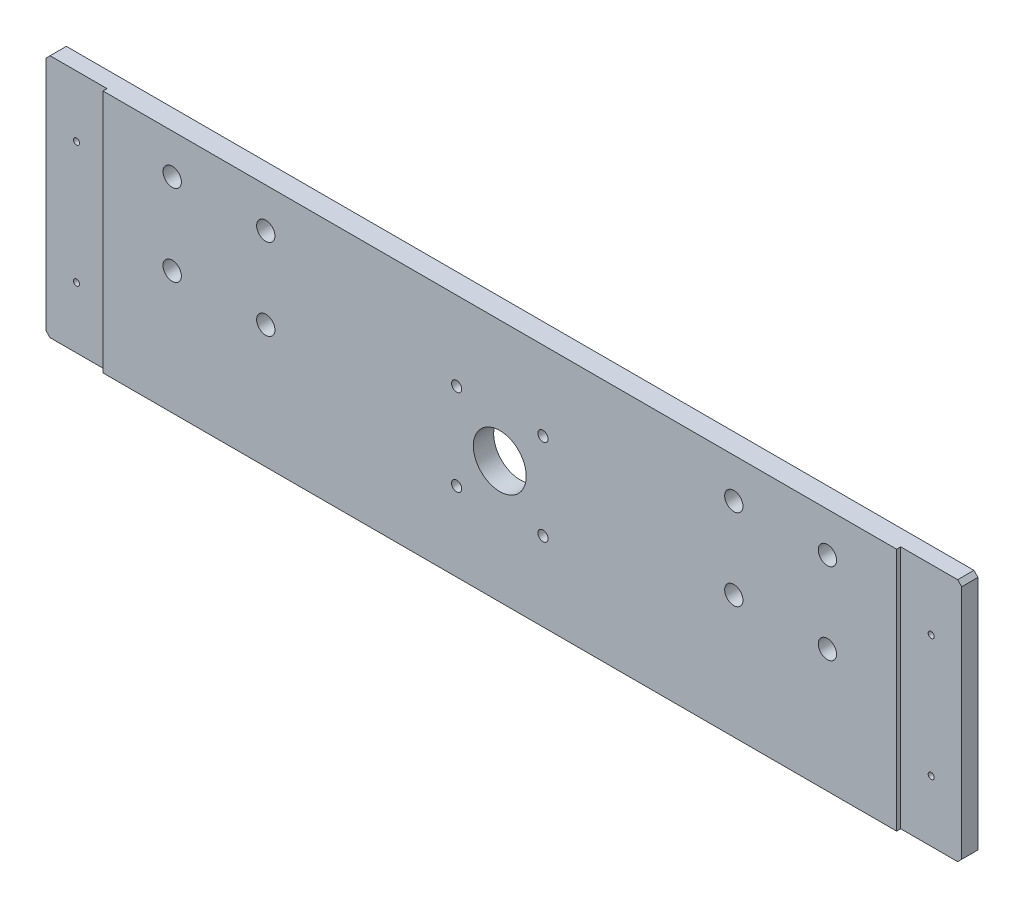
from build123d import *

# Parameters (mm, degrees)
SCHIZZO1_R                   = 13
SCHIZZO1_R_2                 = 2.5
SCHIZZO1_R_3                 = 4.5
SCHIZZO1_R_4                 = 1.5
ESTRUSIONE_ESTRUSIONE1_DEPTH = 10
SCHIZZO2_W                   = 30
SCHIZZO2_H                   = 120
TAGLIO_ESTRUSIONE1_DEPTH     = 2


with BuildPart() as part:
    # Schizzo1 → Estrusione-Estrusione1 (new body)
    with BuildSketch(Plane.XY):
        Polygon((2, 0), (448, 0), (450, 2), (450, 118), (448, 120), (2, 120), (0, 118), (0, 2), align=None)
        with Locations((225, 60)):
            Circle(SCHIZZO1_R, mode=Mode.SUBTRACT)
        with Locations((246.213203436, 81.213203436)):
            Circle(SCHIZZO1_R_2, mode=Mode.SUBTRACT)
        with Locations((386, 100.5)):
            Circle(SCHIZZO1_R_3, mode=Mode.SUBTRACT)
        with Locations((246.213203436, 38.786796564)):
            Circle(SCHIZZO1_R_2, mode=Mode.SUBTRACT)
        with Locations((203.786796564, 38.786796564)):
            Circle(SCHIZZO1_R_2, mode=Mode.SUBTRACT)
        with Locations((110, 100.5)):
            Circle(SCHIZZO1_R_3, mode=Mode.SUBTRACT)
        with Locations((110, 60.5)):
            Circle(SCHIZZO1_R_3, mode=Mode.SUBTRACT)
        with Locations((64, 60.5)):
            Circle(SCHIZZO1_R_3, mode=Mode.SUBTRACT)
        with Locations((64, 100.5)):
            Circle(SCHIZZO1_R_3, mode=Mode.SUBTRACT)
        with Locations((386, 60.5)):
            Circle(SCHIZZO1_R_3, mode=Mode.SUBTRACT)
        with Locations((15, 30)):
            Circle(SCHIZZO1_R_4, mode=Mode.SUBTRACT)
        with Locations((435, 30)):
            Circle(SCHIZZO1_R_4, mode=Mode.SUBTRACT)
        with Locations((203.786796564, 81.213203436)):
            Circle(SCHIZZO1_R_2, mode=Mode.SUBTRACT)
        with Locations((340, 60.5)):
            Circle(SCHIZZO1_R_3, mode=Mode.SUBTRACT)
        with Locations((340, 100.5)):
            Circle(SCHIZZO1_R_3, mode=Mode.SUBTRACT)
        with Locations((435, 90)):
            Circle(SCHIZZO1_R_4, mode=Mode.SUBTRACT)
        with Locations((15, 90)):
            Circle(SCHIZZO1_R_4, mode=Mode.SUBTRACT)
    extrude(amount=-ESTRUSIONE_ESTRUSIONE1_DEPTH)

    # Schizzo2 → Taglio-Estrusione1 (cut)
    with BuildSketch(Plane.XY):
        with Locations((15, 60)):
            Rectangle(SCHIZZO2_W, SCHIZZO2_H)
        with Locations((435, 60)):
            Rectangle(SCHIZZO2_W, SCHIZZO2_H)
    extrude(amount=-TAGLIO_ESTRUSIONE1_DEPTH, mode=Mode.SUBTRACT)


solid = part.part
